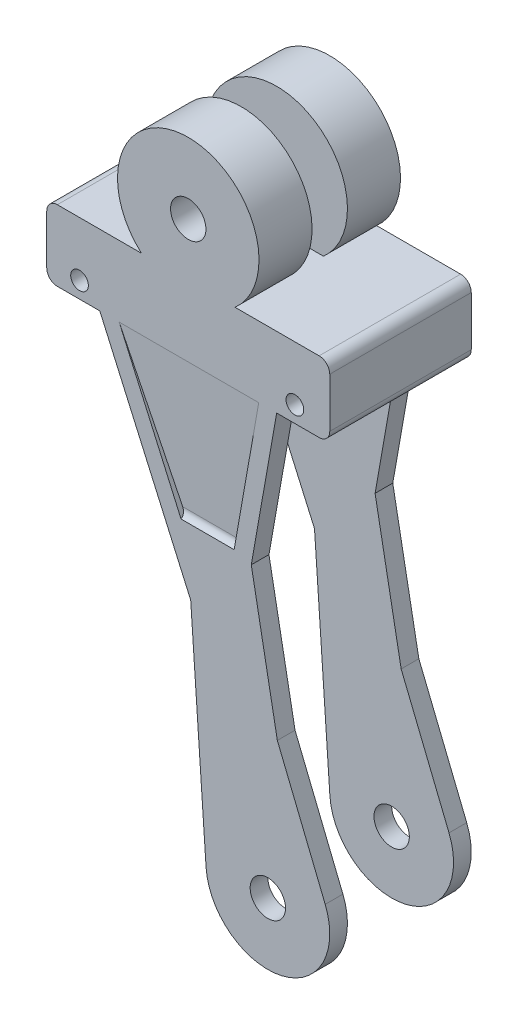
from build123d import *

# Parameters (mm, degrees)
SALIENTE_EXTRUIR1_DEPTH    = 40
CROQUIS2_R                 = 5
SALIENTE_EXTRUIR2_DEPTH    = 5
SALIENTE_EXTRUIR3_START    = -35
CROQUIS2_4_R               = 5
SALIENTE_EXTRUIR3_DEPTH    = 5
CORTAR_EXTRUIR1_DEPTH      = 167.172965861
REDONDEO5_R                = 2
CORTAR_EXTRUIR2_DEPTH      = 5
CORTAR_EXTRUIR3_DEPTH      = 164.7261433
CORTAR_EXTRUIR3_DEPTH_BACK = 164.7261433
CROQUIS4_4_R               = 2.5
SALIENTE_EXTRUIR5_START    = 20
CROQUIS7_R                 = 20
CROQUIS7_R_2               = 5
SALIENTE_EXTRUIR5_DEPTH    = 15
SALIENTE_EXTRUIR6_START    = -5
CROQUIS7_2_R               = 20
CROQUIS7_2_R_2             = 5
SALIENTE_EXTRUIR6_DEPTH    = 15


with BuildPart() as part:
    # Croquis1 → Saliente-Extruir1 (new body)
    with BuildSketch(Plane.XY):
        with BuildLine():
            Line((-37, 0), (37, 0))
            ThreePointArc((37, 0), (39.121320344, -0.878679656), (40, -3))
            Line((40, -3), (40, -17))
            ThreePointArc((40, -17), (39.121320344, -19.121320344), (37, -20))
            Line((37, -20), (-37, -20))
            ThreePointArc((-37, -20), (-39.121320344, -19.121320344), (-40, -17))
            Line((-40, -17), (-40, -3))
            ThreePointArc((-40, -3), (-39.121320344, -0.878679656), (-37, 0))
        make_face()
    extrude(amount=SALIENTE_EXTRUIR1_DEPTH)

    # Croquis2 → Saliente-Extruir2 (add)
    with BuildSketch(Plane.XY.offset(40)):
        with BuildLine():
            Line((-25, -20), (0.692322562, -77.955122319))
            Line((0.692322562, -77.955122319), (5.041226188, -141.200506964))
            ThreePointArc((5.041226188, -141.200506964), (26.438391415, -157.05107249), (38.716761316, -133.422260844))
            Line((38.716761316, -133.422260844), (25.186319846, -100.064303858))
            Line((25.186319846, -100.064303858), (17.814778444, -60.749416381))
            Line((17.814778444, -60.749416381), (25, -20))
            Line((25, -20), (0, -20))
            Line((0, -20), (-25, -20))
        make_face()
        with Locations((22.5, -140)):
            Circle(CROQUIS2_R, mode=Mode.SUBTRACT)
    extrude(amount=-SALIENTE_EXTRUIR2_DEPTH)

    # Croquis2<4> → Saliente-Extruir3 (add)
    with BuildSketch(Plane.XY.offset(40).offset(SALIENTE_EXTRUIR3_START)):
        with BuildLine():
            Line((-25, -20), (0.692322562, -77.955122319))
            Line((0.692322562, -77.955122319), (5.041226188, -141.200506964))
            ThreePointArc((5.041226188, -141.200506964), (26.438391415, -157.05107249), (38.716761316, -133.422260844))
            Line((38.716761316, -133.422260844), (25.186319846, -100.064303858))
            Line((25.186319846, -100.064303858), (17.814778444, -60.749416381))
            Line((17.814778444, -60.749416381), (25, -20))
            Line((25, -20), (0, -20))
            Line((0, -20), (-25, -20))
        make_face()
        with Locations((22.5, -140)):
            Circle(CROQUIS2_4_R, mode=Mode.SUBTRACT)
    extrude(amount=-SALIENTE_EXTRUIR3_DEPTH)

    # Croquis3 → Cortar-Extruir1 (cut, through all)
    with BuildSketch(Plane(origin=(0, -1.419488972, 40.648845743), x_dir=(1, 0, 0), z_dir=(0, -0.034899496702501046, 0.9993908270190958))):
        Polygon((-19.530157581, -18.591836672), (19.922773595, -18.591836672), (12.964371873, -58.030854026), (-2.035628127, -58.030854026), align=None)
    extrude(amount=CORTAR_EXTRUIR1_DEPTH, mode=Mode.SUBTRACT)

    # Redondeo5
    # the kernel refuses this fillet: 2 mm, written as the material it adds along each edge
    with BuildSketch(Plane(origin=(17.715799962, -59.41499217, 38.623598144), x_dir=(0, 0.9993908270190957, 0.03489949670250261), z_dir=(-1, 0, 0))) as redondeo5_piece_1:
        with BuildLine():
            CenterArc((1.900571235, -2), REDONDEO5_R, 90, 71.857609754)
            Line((0, -1.377240834), (-0.038011425, -1.364785651))
            ThreePointArc((-0.038011425, -1.364785651), (-0.04, -0.688620417), (-0.04, 0))
            Line((-0.04, 0), (0, 0.04))
            Line((0, 0.04), (1.900571235, 0.04))
            Line((1.900571235, 0.04), (1.900571235, 0))
        make_face()
    extrude(amount=24.502856177)

    # Croquis4 → Cortar-Extruir2 (cut, symmetric)
    with BuildSketch(Plane.XY.offset(20)):
        with BuildLine():
            Line((-36.464835441, -15.405002376), (-36.464835441, -20))
            Line((-36.464835441, -20), (-25, -20))
            Line((-25, -20), (-25, -15.405002376))
            ThreePointArc((-25, -15.405002376), (-30.732417721, -9.672584656), (-36.464835441, -15.405002376))
        make_face()
        with BuildLine():
            Line((36.338744123, -15.405012958), (36.338744123, -20))
            Line((36.338744123, -20), (23.961776552, -20))
            Line((23.961776552, -20), (23.961776552, -15.405012958))
            ThreePointArc((23.961776552, -15.405012958), (30.150260338, -9.216529173), (36.338744123, -15.405012958))
        make_face()
    extrude(amount=CORTAR_EXTRUIR2_DEPTH, both=True, mode=Mode.SUBTRACT)

    # Croquis4<4> → Cortar-Extruir3 (cut, two sides: drawn at the far end of the back side and taken through both)
    with BuildSketch(Plane.XY.offset(20).offset(-CORTAR_EXTRUIR3_DEPTH_BACK)):
        with Locations((-30.732417721, -15.405002376)):
            Circle(CROQUIS4_4_R)
        with Locations((30.150260338, -15.405012958)):
            Circle(CROQUIS4_4_R)
    extrude(amount=CORTAR_EXTRUIR3_DEPTH + CORTAR_EXTRUIR3_DEPTH_BACK, mode=Mode.SUBTRACT)

    # Croquis7 → Saliente-Extruir5 (add)
    with BuildSketch(Plane.XY.offset(20).offset(SALIENTE_EXTRUIR5_START)):
        with Locations((0, 15)):
            Circle(CROQUIS7_R)
        with Locations(Location((0, 15, 0), (0, 0, 180))):
            Circle(CROQUIS7_R_2, mode=Mode.SUBTRACT)
    extrude(amount=-SALIENTE_EXTRUIR5_DEPTH)

    # Croquis7<2> → Saliente-Extruir6 (add)
    with BuildSketch(Plane.XY.offset(20).offset(SALIENTE_EXTRUIR6_START)):
        with Locations((0, 15)):
            Circle(CROQUIS7_2_R)
        with Locations(Location((0, 15, 0), (0, 0, 180))):
            Circle(CROQUIS7_2_R_2, mode=Mode.SUBTRACT)
    extrude(amount=-SALIENTE_EXTRUIR6_DEPTH)


solid = part.part
